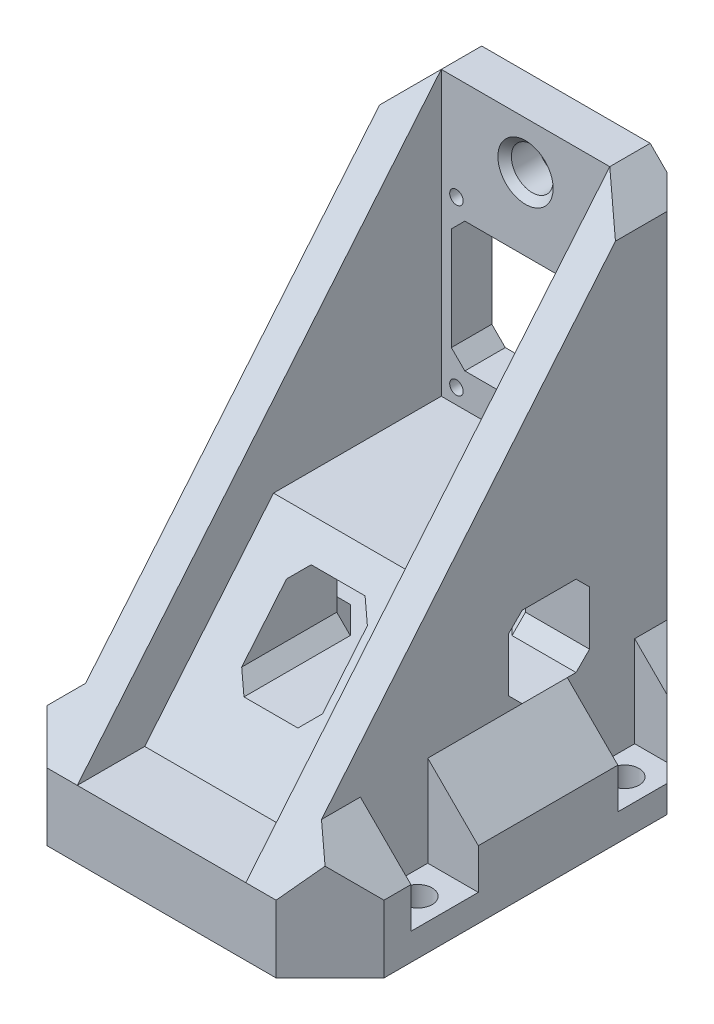
from build123d import *

# Parameters (mm, degrees)
SKETCH1_W           = 50
SKETCH1_H           = 60
BOSS_EXTRUDE1_DEPTH = 10
SKETCH2_R           = 2.15
CUT_EXTRUDE1_DEPTH  = 4
SKETCH5_W           = 25
SKETCH5_H           = 6
BOSS_EXTRUDE3_DEPTH = 65
CUT_EXTRUDE3_REACH  = 101.247
SKETCH6_W           = 22
SKETCH6_H           = 19.25
SKETCH7_R           = 1
CUT_EXTRUDE4_DEPTH  = 2.5
CUT_EXTRUDE5_REACH  = 99.171
SKETCH8_R           = 2
BOSS_EXTRUDE4_DEPTH = 5
CHAMFER1_SIZE       = 7.5
CHAMFER2_SIZE       = 10
CHAMFER4_SIZE       = 5.5
CHAMFER5_SIZE       = 5
CHAMFER7_SIZE       = 2
CUT_EXTRUDE6_REACH  = 101.247
SKETCH10_R          = 3.1
CHAMFER8_SIZE       = 1
BOSS_EXTRUDE5_REACH = 91.058
CHAMFER9_SIZE       = 8
CUT_EXTRUDE7_REACH  = 101.247
SKETCH12_W          = 12
SKETCH12_H          = 12
CUT_EXTRUDE9_REACH  = 88.522
SKETCH14_W          = 12
SKETCH14_H          = 12
CHAMFER11_SIZE      = 2
CUT_EXTRUDE11_REACH = 93.276
SKETCH16_W          = 10
SKETCH16_H          = 13.5
SKETCH17_W          = 10
SKETCH17_H          = 13.5
CUT_EXTRUDE12_DEPTH = 7.5


# Some blends are built 0.0001 mm under size
with BuildPart() as part:
    # Sketch1 → Boss-Extrude1 (new body)
    with BuildSketch(Plane(origin=(0, 0, 0), x_dir=(1, 0, 0), z_dir=(0, 1, 0))):
        Rectangle(SKETCH1_W, SKETCH1_H)
    extrude(amount=BOSS_EXTRUDE1_DEPTH)

    # Sketch2 → Cut-Extrude1 (cut)
    with BuildSketch(Plane(origin=(0, 0, 0), x_dir=(1, 0, 0), z_dir=(0, 1, 0))):
        with Locations(Location((-21, 17.7, 0), (0, 0, 270))):
            Circle(SKETCH2_R)
        with Locations(Location((-21, -13, 0), (0, 0, 270))):
            Circle(SKETCH2_R)
        with Locations(Location((21, 17.7, 0), (0, 0, 270))):
            Circle(SKETCH2_R)
        with Locations(Location((21, -13, 0), (0, 0, 270))):
            Circle(SKETCH2_R)
    extrude(amount=CUT_EXTRUDE1_DEPTH, mode=Mode.SUBTRACT)

    # Sketch5 → Boss-Extrude3 (add)
    with BuildSketch(Plane(origin=(0, 10, 0), x_dir=(1, 0, 0), z_dir=(0, 1, 0))):
        with Locations((0, 27)):
            Rectangle(SKETCH5_W, SKETCH5_H)
    extrude(amount=BOSS_EXTRUDE3_DEPTH)

    # Sketch6 → Cut-Extrude3 (cut, up to next)
    with BuildSketch(Plane(origin=(0, 0, -30), x_dir=(-1, 0, 0), z_dir=(0, 0, -1)), mode=Mode.PRIVATE) as cut_extrude3_sk1:
        with Locations((0, 47.625)):
            Rectangle(SKETCH6_W, SKETCH6_H)
    cut_extrude3_tool1 = extrude(cut_extrude3_sk1.sketch, amount=-CUT_EXTRUDE3_REACH, mode=Mode.PRIVATE) & part.part
    add(cut_extrude3_tool1.solids().sort_by_distance((0, 47.625, -30))[0], mode=Mode.SUBTRACT)

    # Sketch7 → Cut-Extrude4 (cut)
    with BuildSketch(Plane.XY.offset(-24)):
        with Locations((10.25, 35.25)):
            Circle(SKETCH7_R)
        with Locations((-10.25, 35.25)):
            Circle(SKETCH7_R)
        with Locations((-10.25, 59.7)):
            Circle(SKETCH7_R)
        with Locations((10.25, 59.7)):
            Circle(SKETCH7_R)
    extrude(amount=-CUT_EXTRUDE4_DEPTH, mode=Mode.SUBTRACT)

    # Sketch8 → Cut-Extrude5 (cut, up to next)
    with BuildSketch(Plane.XY.offset(-26.5), mode=Mode.PRIVATE) as cut_extrude5_sk1:
        with Locations((-10.25, 59.7)):
            Circle(SKETCH8_R)
    cut_extrude5_tool1 = extrude(cut_extrude5_sk1.sketch, amount=-CUT_EXTRUDE5_REACH, mode=Mode.PRIVATE) & part.part
    # Sketch8 → Cut-Extrude5 (cut, up to next)
    with BuildSketch(Plane.XY.offset(-26.5), mode=Mode.PRIVATE) as cut_extrude5_sk2:
        with Locations((10.25, 59.7)):
            Circle(SKETCH8_R)
    cut_extrude5_tool2 = extrude(cut_extrude5_sk2.sketch, amount=-CUT_EXTRUDE5_REACH, mode=Mode.PRIVATE) & part.part
    # Sketch8 → Cut-Extrude5 (cut, up to next)
    with BuildSketch(Plane.XY.offset(-26.5), mode=Mode.PRIVATE) as cut_extrude5_sk3:
        with Locations((10.25, 35.25)):
            Circle(SKETCH8_R)
    cut_extrude5_tool3 = extrude(cut_extrude5_sk3.sketch, amount=-CUT_EXTRUDE5_REACH, mode=Mode.PRIVATE) & part.part
    # Sketch8 → Cut-Extrude5 (cut, up to next)
    with BuildSketch(Plane.XY.offset(-26.5), mode=Mode.PRIVATE) as cut_extrude5_sk4:
        with Locations((-10.25, 35.25)):
            Circle(SKETCH8_R)
    cut_extrude5_tool4 = extrude(cut_extrude5_sk4.sketch, amount=-CUT_EXTRUDE5_REACH, mode=Mode.PRIVATE) & part.part
    add(cut_extrude5_tool1.solids().sort_by_distance((-10.25, 59.7, -26.5))[0], mode=Mode.SUBTRACT)
    add(cut_extrude5_tool2.solids().sort_by_distance((10.25, 59.7, -26.5))[0], mode=Mode.SUBTRACT)
    add(cut_extrude5_tool3.solids().sort_by_distance((10.25, 35.25, -26.5))[0], mode=Mode.SUBTRACT)
    add(cut_extrude5_tool4.solids().sort_by_distance((-10.25, 35.25, -26.5))[0], mode=Mode.SUBTRACT)

    # Sketch9 → Boss-Extrude4 (add)
    with BuildSketch(Plane(origin=(12.5, 0, 0), x_dir=(0, 0, -1), z_dir=(1, 0, 0))):
        Polygon((30, 75), (24, 75), (-30, 10), (30, 10), align=None)
    boss_extrude4 = extrude(amount=BOSS_EXTRUDE4_DEPTH)

    # Mirror1: Boss-Extrude4 across plane
    add(boss_extrude4.mirror(Plane(origin=(0, 0, 0), x_dir=(0, 0, 1), z_dir=(1, 0, 0))))

    # Chamfer1
    chamfer1_edges = [part.edges().sort_by_distance(p)[0] for p in [
        (17.5, 10, 0),
        (-17.5, 10, 0),
    ]]
    chamfer(chamfer1_edges, length=CHAMFER1_SIZE - 0.0001)  # a hair under: the kernel refuses the full size

    # Chamfer2
    chamfer2_edges = [part.edges().sort_by_distance(p)[0] for p in [
        (-25, 5, -30),
        (25, 5, -30),
    ]]
    chamfer(chamfer2_edges, length=CHAMFER2_SIZE)

    # Chamfer4
    chamfer4_edges = [part.edges().sort_by_distance(p)[0] for p in [
        (0, 0, -30),
    ]]
    chamfer(chamfer4_edges, length=CHAMFER4_SIZE)

    # Chamfer5
    chamfer5_edges = [part.edges().sort_by_distance(p)[0] for p in [
        (17.5, 75, -25.75),
        (-17.5, 75, -25.75),
    ]]
    chamfer(chamfer5_edges, length=CHAMFER5_SIZE)

    # Chamfer7
    chamfer7_edges = [part.edges().sort_by_distance(p)[0] for p in [
        (-11, 57.25, -27),
        (-11, 38, -27),
        (11, 38, -27),
        (11, 57.25, -27),
    ]]
    chamfer(chamfer7_edges, length=CHAMFER7_SIZE)

    # Sketch10 → Cut-Extrude6 (cut, up to next)
    with BuildSketch(Plane(origin=(0, 0, -30), x_dir=(-1, 0, 0), z_dir=(0, 0, -1)), mode=Mode.PRIVATE) as cut_extrude6_sk1:
        with Locations((0, 68)):
            Circle(SKETCH10_R)
    cut_extrude6_tool1 = extrude(cut_extrude6_sk1.sketch, amount=-CUT_EXTRUDE6_REACH, mode=Mode.PRIVATE) & part.part
    add(cut_extrude6_tool1.solids().sort_by_distance((0, 68, -30))[0], mode=Mode.SUBTRACT)

    # Chamfer8
    chamfer8_edges = [part.edges().sort_by_distance(p)[0] for p in [
        (3.1, 68, -30),
        (3.1, 68, -24),
    ]]
    chamfer(chamfer8_edges, length=CHAMFER8_SIZE)

    # Sketch11 → Boss-Extrude5 (add, up to next)
    with BuildSketch(Plane(origin=(-12.5, 0, 0), x_dir=(0, 0, -1), z_dir=(1, 0, 0)), mode=Mode.PRIVATE) as boss_extrude5_sk1:
        Polygon((-20, 10), (24, 10), (24, 33), (-0.892307692, 33), align=None)
    boss_extrude5_tool1 = extrude(boss_extrude5_sk1.sketch, amount=BOSS_EXTRUDE5_REACH, mode=Mode.PRIVATE) - part.part
    add(boss_extrude5_tool1.solids().sort_by_distance((-12.5, 20.436802, -6.335287))[0])

    # Chamfer9
    # the kernel refuses this chamfer: 8 mm, written as the material it takes off along each edge
    with BuildSketch(Plane(origin=(25, -20.573463904, 30), x_dir=(0.027495876610586487, 0, -0.9996219169112968), z_dir=(0, 1, 0))) as chamfer9_piece_1:
        Polygon((CHAMFER9_SIZE * 0.999621916911, CHAMFER9_SIZE * 0.0274958766106), (-CHAMFER9_SIZE * 0.0274958766106, CHAMFER9_SIZE * 0.999621916911), (0, 0), align=None)
    extrude(amount=51.146927807, mode=Mode.SUBTRACT)
    with BuildSketch(Plane(origin=(-25, -20.573463904, 30), x_dir=(-0.027495876610586487, 0, -0.9996219169112968), z_dir=(0, 1, 0))) as chamfer9_piece_2:
        Polygon((CHAMFER9_SIZE * 0.999621916911, -CHAMFER9_SIZE * 0.0274958766106), (-CHAMFER9_SIZE * 0.0274958766106, -CHAMFER9_SIZE * 0.999621916911), (0, 0), align=None)
    extrude(amount=51.146927807, mode=Mode.SUBTRACT)

    # Cut-Extrude7: up to this plane
    cut_extrude7_end = Plane(origin=(25.002, 33, 0.892307692), z_dir=(0, -0.6390196945354668, -0.7691903730519506))
    # Sketch12 → Cut-Extrude7 (cut, up to the surface)
    with BuildSketch(Plane(origin=(0, 0, -30), x_dir=(-1, 0, 0), z_dir=(0, 0, -1)), mode=Mode.PRIVATE) as cut_extrude7_sk1:
        with Locations((0, 23.5)):
            Rectangle(SKETCH12_W, SKETCH12_H)
    cut_extrude7_tool1 = split(extrude(cut_extrude7_sk1.sketch, amount=-CUT_EXTRUDE7_REACH, mode=Mode.PRIVATE), bisect_by=cut_extrude7_end, keep=Keep.BOTH, mode=Mode.PRIVATE)
    add(cut_extrude7_tool1.solids().sort_by_distance((0, 23.5, -30))[0], mode=Mode.SUBTRACT)

    # Sketch14 → Cut-Extrude9 (cut, up to next)
    with BuildSketch(Plane(origin=(-6, 0, 0), x_dir=(0, 0, -1), z_dir=(1, 0, 0)), mode=Mode.PRIVATE) as cut_extrude9_sk1:
        with Locations((10, 23.5)):
            Rectangle(SKETCH14_W, SKETCH14_H)
    cut_extrude9_tool1 = extrude(cut_extrude9_sk1.sketch, amount=-CUT_EXTRUDE9_REACH, mode=Mode.PRIVATE) & part.part
    cut_extrude9 = cut_extrude9_tool1.solids().sort_by_distance((-6, 23.5, -10))[0]
    add(cut_extrude9, mode=Mode.SUBTRACT)

    # Mirror2: Cut-Extrude9 across plane
    add(cut_extrude9.mirror(Plane(origin=(0, 0, 0), x_dir=(0, 0, 1), z_dir=(1, 0, 0))), mode=Mode.SUBTRACT)

    # Chamfer11
    chamfer11_edges = [part.edges().sort_by_distance(p)[0] for p in [
        (-6, 17.5, 4.884615385),
        (6, 17.5, 4.884615385),
        (6, 29.5, -0.1),
        (-6, 29.5, -0.1),
        (-6, 17.5, -23),
        (-6, 29.5, -23),
        (-11.75, 17.5, -16),
        (-11.75, 29.5, -16),
        (-11.75, 17.5, -4),
        (-11.75, 29.5, -4),
        (-6, 23.5, -16),
        (-6, 23.5, -4),
        (6, 29.5, -23),
        (6, 17.5, -23),
        (11.75, 17.5, -4),
        (11.75, 17.5, -16),
        (6, 23.5, -16),
        (11.75, 29.5, -16),
        (11.75, 29.5, -4),
        (6, 23.5, -4),
    ]]
    chamfer(chamfer11_edges, length=CHAMFER11_SIZE)

    # Sketch16 → Cut-Extrude11 (cut, up to next)
    with BuildSketch(Plane(origin=(17.5, 0, 0), x_dir=(0, 0, -1), z_dir=(1, 0, 0)), mode=Mode.PRIVATE) as cut_extrude11_sk1:
        with Locations((-13, 10.75)):
            Rectangle(SKETCH16_W, SKETCH16_H)
    cut_extrude11_tool1 = extrude(cut_extrude11_sk1.sketch, amount=CUT_EXTRUDE11_REACH, mode=Mode.PRIVATE) & part.part
    cut_extrude11 = cut_extrude11_tool1.solids().sort_by_distance((17.5, 10.75, 13))[0]
    add(cut_extrude11, mode=Mode.SUBTRACT)

    # Sketch17 → Cut-Extrude12 (cut)
    with BuildSketch(Plane(origin=(17.5, 0, 0), x_dir=(0, 0, -1), z_dir=(1, 0, 0))):
        with Locations((17.7, 10.75)):
            Rectangle(SKETCH17_W, SKETCH17_H)
    cut_extrude12 = extrude(amount=CUT_EXTRUDE12_DEPTH, mode=Mode.SUBTRACT)

    # Mirror4: Cut-Extrude11, Cut-Extrude12 across plane
    add(cut_extrude11.mirror(Plane(origin=(0, 0, 0), x_dir=(0, 0, 1), z_dir=(1, 0, 0))), mode=Mode.SUBTRACT)
    add(cut_extrude12.mirror(Plane(origin=(0, 0, 0), x_dir=(0, 0, 1), z_dir=(1, 0, 0))), mode=Mode.SUBTRACT)


solid = part.part
